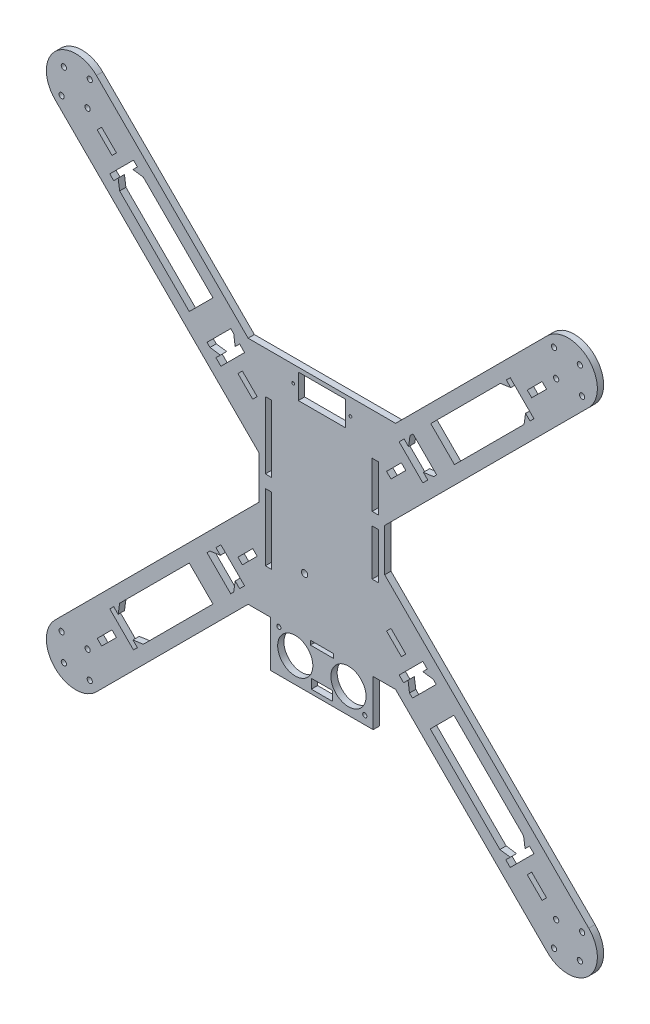
from build123d import *

# Parameters (mm, degrees)
BOSS_EXTRUDE1_DEPTH = 3
SKETCH4_R           = 1.25
CUT_EXTRUDE1_DEPTH  = 3
SKETCH5_R           = 0.65
SKETCH5_W           = 22.5
SKETCH5_H           = 11.8
CUT_EXTRUDE2_DEPTH  = 3
SKETCH6_R           = 1.5
CUT_EXTRUDE3_DEPTH  = 3
SKETCH7_R           = 1
SKETCH7_R_2         = 8.4
SKETCH7_W           = 11
SKETCH7_H           = 2
SKETCH7_W_2         = 10
SKETCH7_H_2         = 4.5
CUT_EXTRUDE4_DEPTH  = 3
CUT_EXTRUDE5_DEPTH  = 186.993279448
BOSS_EXTRUDE2_REACH = 195.992
SKETCH9_W           = 3
SKETCH9_H           = 12
BOSS_EXTRUDE3_REACH = 195.992
SKETCH11_W          = 3
SKETCH11_H          = 12
BOSS_EXTRUDE4_REACH = 195.992
SKETCH12_W          = 3
SKETCH12_H          = 12
BOSS_EXTRUDE5_REACH = 195.992
SKETCH13_W          = 3
SKETCH13_H          = 12
SKETCH14_W          = 3
SKETCH14_H          = 32
SKETCH14_H_2        = 22
CUT_EXTRUDE6_DEPTH  = 186.993279448


with BuildPart() as part:
    # Sketch1 → Boss-Extrude1 (new body)
    with BuildSketch(Plane.XY):
        with BuildLine():
            Line((35.201010127, 55), (-35.201010127, 55))
            Line((-35.201010127, 55), (-107.600505063, 127.399494937))
            ThreePointArc((-107.600505063, 127.399494937), (-127.399494937, 127.399494937), (-127.399494937, 107.600505063))
            Line((-127.399494937, 107.600505063), (-30, 10.201010127))
            Line((-30, 10.201010127), (-30, -10.201010127))
            Line((-30, -10.201010127), (-127.399494937, -107.600505063))
            ThreePointArc((-127.399494937, -107.600505063), (-127.399494937, -127.399494937), (-107.600505063, -127.399494937))
            Line((-107.600505063, -127.399494937), (-35.201010127, -55))
            Line((-35.201010127, -55), (-24.5, -55))
            Line((-24.5, -55), (-24.5, -77))
            Line((-24.5, -77), (24.5, -77))
            Line((24.5, -77), (24.5, -55))
            Line((24.5, -55), (35.201010127, -55))
            Line((35.201010127, -55), (107.600505063, -127.399494937))
            ThreePointArc((107.600505063, -127.399494937), (127.399494937, -127.399494937), (127.399494937, -107.600505063))
            Line((127.399494937, -107.600505063), (30, -10.201010127))
            Line((30, -10.201010127), (30, 10.201010127))
            Line((30, 10.201010127), (127.399494937, 107.600505063))
            ThreePointArc((127.399494937, 107.600505063), (127.399494937, 127.399494937), (107.600505063, 127.399494937))
            Line((107.600505063, 127.399494937), (35.201010127, 55))
        make_face()
    extrude(amount=-BOSS_EXTRUDE1_DEPTH)

    # Sketch4 → Cut-Extrude1 (cut)
    with BuildSketch(Plane.XY):
        with Locations((-110.782485579, 124.217514421)):
            Circle(SKETCH4_R)
        with Locations((-124.217514421, 110.782485579)):
            Circle(SKETCH4_R)
        with Locations((-123.156854249, 123.156854249)):
            Circle(SKETCH4_R)
        with Locations((-111.843145751, 111.843145751)):
            Circle(SKETCH4_R)
        with Locations((111.843145751, 111.843145751)):
            Circle(SKETCH4_R)
        with Locations((110.782485579, 124.217514421)):
            Circle(SKETCH4_R)
        with Locations((123.156854249, 123.15685425)):
            Circle(SKETCH4_R)
        with Locations((124.217514421, 110.782485579)):
            Circle(SKETCH4_R)
        with Locations((111.843145751, -111.84314575)):
            Circle(SKETCH4_R)
        with Locations((124.217514421, -110.782485579)):
            Circle(SKETCH4_R)
        with Locations((123.15685425, -123.156854249)):
            Circle(SKETCH4_R)
        with Locations((110.782485579, -124.217514421)):
            Circle(SKETCH4_R)
        with Locations((-111.84314575, -111.843145751)):
            Circle(SKETCH4_R)
        with Locations((-110.782485579, -124.217514421)):
            Circle(SKETCH4_R)
        with Locations((-123.156854249, -123.156854249)):
            Circle(SKETCH4_R)
        with Locations((-124.217514421, -110.782485579)):
            Circle(SKETCH4_R)
    extrude(amount=-CUT_EXTRUDE1_DEPTH, mode=Mode.SUBTRACT)

    # Sketch5 → Cut-Extrude2 (cut)
    with BuildSketch(Plane.XY):
        with Locations((-13.65, 47.1)):
            Circle(SKETCH5_R)
        with Locations((13.65, 47.1)):
            Circle(SKETCH5_R)
        with Locations((0, 47.1)):
            Rectangle(SKETCH5_W, SKETCH5_H)
    extrude(amount=-CUT_EXTRUDE2_DEPTH, mode=Mode.SUBTRACT)

    # Sketch6 → Cut-Extrude3 (cut)
    with BuildSketch(Plane.XY):
        with Locations((-8.25, -28.8)):
            Circle(SKETCH6_R)
    extrude(amount=-CUT_EXTRUDE3_DEPTH, mode=Mode.SUBTRACT)

    # Sketch7 → Cut-Extrude4 (cut)
    with BuildSketch(Plane.XY):
        with Locations((-20.5, -57)):
            Circle(SKETCH7_R)
        with Locations((-12.7, -65)):
            Circle(SKETCH7_R_2)
        with Locations((12.7, -65)):
            Circle(SKETCH7_R_2)
        with Locations((20.5, -73)):
            Circle(SKETCH7_R)
        with Locations((0, -56)):
            Rectangle(SKETCH7_W, SKETCH7_H)
        with Locations((0, -72.75)):
            Rectangle(SKETCH7_W_2, SKETCH7_H_2)
    extrude(amount=-CUT_EXTRUDE4_DEPTH, mode=Mode.SUBTRACT)

    # Sketch8 → Cut-Extrude5 (cut, through all)
    with BuildSketch(Plane.XY):
        Polygon((101.236544033, -89.922835534), (89.922835534, -101.236544033), (87.80151519, -99.115223689), (89.922835534, -96.993903346), (84.973088065, -96.286796564), (41.839574413, -53.153282912), (41.132467632, -48.203535444), (39.011147288, -50.324855787), (36.889826945, -48.203535444), (48.203535444, -36.889826945), (50.324855787, -39.011147288), (48.203535444, -41.132467632), (53.153282912, -41.839574413), (96.286796564, -84.973088065), (96.993903346, -89.922835534), (99.115223689, -87.80151519), align=None)
        Polygon((40.07180746, -37.950487117), (37.950487117, -40.07180746), (30.879419305, -33.000739648), (33.000739648, -30.879419305), align=None)
        Polygon((50.567496474, 39.253787975), (48.203535444, 36.889826945), (36.889826945, 48.203535444), (39.253787975, 50.567496474), (41.375108319, 48.446176131), (42.0822151, 53.395923599), (85.215728753, 96.529437252), (90.165476221, 97.236544033), (88.044155877, 99.357864376), (89.922835534, 101.236544033), (101.236544033, 89.922835534), (99.357864376, 88.044155877), (97.236544033, 90.165476221), (96.529437252, 85.215728753), (53.395923599, 42.0822151), (48.446176131, 41.375108319), align=None)
        Polygon((100.175883861, -98.054563517), (98.054563517, -100.175883861), (105.125631329, -107.246951673), (107.246951673, -105.125631329), align=None)
        Polygon((-101.236544033, -89.922835534), (-99.357864376, -88.044155877), (-97.236544033, -90.165476221), (-96.529437252, -85.215728753), (-53.395923599, -42.0822151), (-48.446176131, -41.375108319), (-50.567496474, -39.253787975), (-48.203535444, -36.889826945), (-36.889826945, -48.203535444), (-39.253787975, -50.567496474), (-41.375108319, -48.446176131), (-42.0822151, -53.395923599), (-85.215728753, -96.529437252), (-90.165476221, -97.236544033), (-88.044155877, -99.357864376), (-89.922835534, -101.236544033), align=None)
        Polygon((-100.175883861, -98.054563517), (-107.246951673, -105.125631329), (-105.125631329, -107.246951673), (-98.054563517, -100.175883861), align=None)
        Polygon((-37.950487117, -40.07180746), (-40.07180746, -37.950487117), (-33.000739648, -30.879419305), (-30.879419305, -33.000739648), align=None)
        Polygon((-89.922835534, 101.236544033), (-88.044155877, 99.357864376), (-90.165476221, 97.236544033), (-85.215728753, 96.529437252), (-42.0822151, 53.395923599), (-41.375108319, 48.446176131), (-39.253787975, 50.567496474), (-36.889826945, 48.203535444), (-48.203535444, 36.889826945), (-50.567496474, 39.253787975), (-48.446176131, 41.375108319), (-53.395923599, 42.0822151), (-96.529437252, 85.215728753), (-97.236544033, 90.165476221), (-99.357864376, 88.044155877), (-101.236544033, 89.922835534), align=None)
        Polygon((-98.054563517, 100.175883861), (-105.125631329, 107.246951673), (-107.246951673, 105.125631329), (-100.175883861, 98.054563517), align=None)
        Polygon((-40.07180746, 37.950487117), (-37.950487117, 40.07180746), (-30.879419305, 33.000739648), (-33.000739648, 30.879419305), align=None)
        Polygon((100.175883861, 98.054563517), (107.246951673, 105.125631329), (105.125631329, 107.246951673), (98.054563517, 100.175883861), align=None)
        Polygon((37.950487117, 40.07180746), (40.07180746, 37.950487117), (33.000739648, 30.879419305), (30.879419305, 33.000739648), align=None)
    extrude(amount=-CUT_EXTRUDE5_DEPTH, mode=Mode.SUBTRACT)

    # Sketch9 → Boss-Extrude2 (add, up to next)
    with BuildSketch(Plane(origin=(-5.656854249, 5.656854249, 0), x_dir=(0, 0, -1), z_dir=(0.70710678118654, -0.707106781186555, 0)), mode=Mode.PRIVATE) as boss_extrude2_sk1:
        with Locations((1.5, 75.513239329)):
            Rectangle(SKETCH9_W, SKETCH9_H)
    boss_extrude2_tool1 = extrude(boss_extrude2_sk1.sketch, amount=BOSS_EXTRUDE2_REACH, mode=Mode.PRIVATE) - part.part
    add(boss_extrude2_tool1.solids().sort_by_distance((47.739069, 59.052778, -1.5))[0])

    # Sketch11 → Boss-Extrude3 (add, up to next)
    with BuildSketch(Plane(origin=(5.656854249, 5.656854249, 0), x_dir=(0, 0, 1), z_dir=(-0.7071067811865477, -0.7071067811865475, 0)), mode=Mode.PRIVATE) as boss_extrude3_sk1:
        with Locations((-1.5, -75.170093579)):
            Rectangle(SKETCH11_W, SKETCH11_H)
    boss_extrude3_tool1 = extrude(boss_extrude3_sk1.sketch, amount=BOSS_EXTRUDE3_REACH, mode=Mode.PRIVATE) - part.part
    add(boss_extrude3_tool1.solids().sort_by_distance((58.810137, -47.496429, -1.5))[0])

    # Sketch12 → Boss-Extrude4 (add, up to next)
    with BuildSketch(Plane(origin=(5.656854249, -5.656854249, 0), x_dir=(0, 0, 1), z_dir=(-0.7071067811865449, 0.7071067811865502, 0)), mode=Mode.PRIVATE) as boss_extrude4_sk1:
        with Locations((-1.5, -75.513239329)):
            Rectangle(SKETCH12_W, SKETCH12_H)
    boss_extrude4_tool1 = extrude(boss_extrude4_sk1.sketch, amount=BOSS_EXTRUDE4_REACH, mode=Mode.PRIVATE) - part.part
    add(boss_extrude4_tool1.solids().sort_by_distance((-47.739069, -59.052778, -1.5))[0])

    # Sketch13 → Boss-Extrude5 (add, up to next)
    with BuildSketch(Plane(origin=(5.656854249, 5.656854249, 0), x_dir=(0, 0, 1), z_dir=(-0.707106781186552, -0.707106781186543, 0)), mode=Mode.PRIVATE) as boss_extrude5_sk1:
        with Locations((-1.5, 75.513239329)):
            Rectangle(SKETCH13_W, SKETCH13_H)
    boss_extrude5_tool1 = extrude(boss_extrude5_sk1.sketch, amount=BOSS_EXTRUDE5_REACH, mode=Mode.PRIVATE) - part.part
    add(boss_extrude5_tool1.solids().sort_by_distance((-47.739069, 59.052778, -1.5))[0])

    # Sketch14 → Cut-Extrude6 (cut, through all)
    with BuildSketch(Plane(origin=(0, 0, -3), x_dir=(-1, 0, 0), z_dir=(0, 0, -1))):
        with Locations((25.5, -19)):
            Rectangle(SKETCH14_W, SKETCH14_H)
        with Locations((25.5, 19)):
            Rectangle(SKETCH14_W, SKETCH14_H)
        with Locations((-25.5, -4)):
            Rectangle(SKETCH14_W, SKETCH14_H_2)
        with Locations((-25.5, 24)):
            Rectangle(SKETCH14_W, SKETCH14_H_2)
    extrude(amount=-CUT_EXTRUDE6_DEPTH, mode=Mode.SUBTRACT)


solid = part.part
